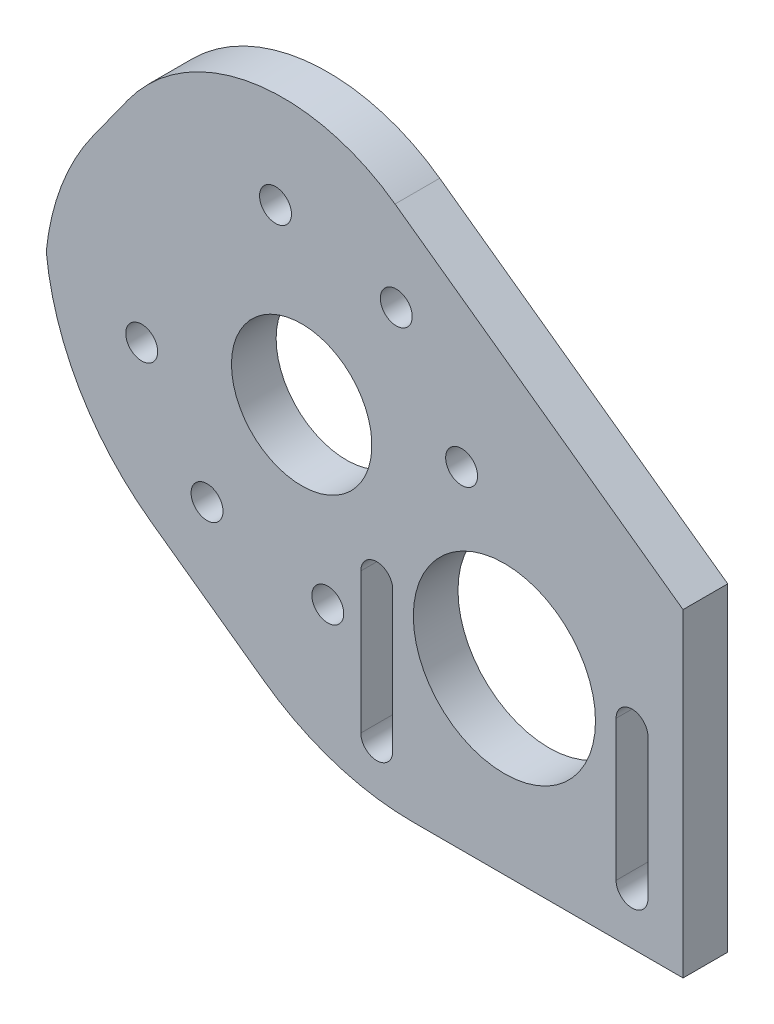
from build123d import *

# Parameters (mm, degrees)
SKETCH1_W               = 100
SKETCH1_H               = 100
BOSS_EXTRUDE1_DEPTH     = 7
SKETCH2_R               = 14.275
CUT_EXTRUDE1_DEPTH      = 142.594491418
SKETCH3_R               = 11
CUT_EXTRUDE2_DEPTH      = 10
SKETCH6_R               = 2.5
CUT_EXTRUDE3_DEPTH      = 142.594491418
CUT_EXTRUDE4_DEPTH      = 142.594491418
CUT_EXTRUDE4_DEPTH_BACK = 142.594491418
FILLET1_R               = 30
FILLET2_R               = 40


with BuildPart() as part:
    # Sketch1 → Boss-Extrude1 (new body)
    with BuildSketch(Plane.XY):
        with Locations((50, 50)):
            Rectangle(SKETCH1_W, SKETCH1_H)
    extrude(amount=BOSS_EXTRUDE1_DEPTH)

    # Sketch2 → Cut-Extrude1 (cut, through all)
    with BuildSketch(Plane.XY.offset(7)):
        with Locations((72, 28)):
            Circle(SKETCH2_R)
        with BuildLine():
            Line((54.5, 30), (54.5, 8))
            ThreePointArc((54.5, 8), (52, 5.5), (49.5, 8))
            Line((49.5, 8), (49.5, 30))
            ThreePointArc((49.5, 30), (52, 32.5), (54.5, 30))
        make_face()
        with BuildLine():
            Line((94.5, 30), (94.5, 8))
            ThreePointArc((94.5, 8), (92, 5.5), (89.5, 8))
            Line((89.5, 8), (89.5, 30))
            ThreePointArc((89.5, 30), (92, 32.5), (94.5, 30))
        make_face()
    extrude(amount=-CUT_EXTRUDE1_DEPTH, mode=Mode.SUBTRACT)

    # Sketch3 → Cut-Extrude2 (cut)
    with BuildSketch(Plane(origin=(0, 0, 0), x_dir=(-1, 0, 0), z_dir=(0, 0, -1))):
        with Locations((-40.225524413, 47.915639612)):
            Circle(SKETCH3_R)
    extrude(amount=-CUT_EXTRUDE2_DEPTH, mode=Mode.SUBTRACT)

    # Sketch6 → Cut-Extrude3 (cut, through all)
    with BuildSketch(Plane(origin=(0, 0, 0), x_dir=(-1, 0, 0), z_dir=(0, 0, -1))):
        with Locations((-15.158085821, 43.818869855)):
            Circle(SKETCH6_R)
        with Locations((-36.128754655, 72.983078204)):
            Circle(SKETCH6_R)
        with Locations((-25.397022274, 27.293430121)):
            Circle(SKETCH6_R)
        with Locations((-44.322294171, 22.848201021)):
            Circle(SKETCH6_R)
        with Locations((-55.054026552, 68.537849104)):
            Circle(SKETCH6_R)
        with Locations((-65.292963005, 52.01240937)):
            Circle(SKETCH6_R)
    extrude(amount=-CUT_EXTRUDE3_DEPTH, mode=Mode.SUBTRACT)

    # Sketch7 → Cut-Extrude4 (cut, two sides: drawn at the far end of the back side and taken through both)
    with BuildSketch(Plane(origin=(0, 0, 0), x_dir=(-1, 0, 0), z_dir=(0, 0, -1)).offset(-CUT_EXTRUDE4_DEPTH_BACK)):
        Polygon((-100, 100), (-100, 50), (-30.50895185, 100), align=None)
        Polygon((0, 100), (-30.50895185, 100), (0, 57.59801916), align=None)
        Polygon((0, 32.194859297), (-44.745090352, 0), (0, 0), align=None)
    extrude(amount=CUT_EXTRUDE4_DEPTH + CUT_EXTRUDE4_DEPTH_BACK, mode=Mode.SUBTRACT)

    # Fillet1
    fillet1_edges = [part.edges().sort_by_distance(p)[0] for p in [
        (30.50895185, 100, 3.5),
    ]]
    fillet(fillet1_edges, radius=FILLET1_R)

    # Fillet2
    # the kernel refuses this fillet: 40 mm, written as the material it takes off along each edge
    with BuildSketch(Plane(origin=(44.745090352, 0, 39.23712894), x_dir=(-0.8117201564538461, 0.5840465628753787, 0), z_dir=(0, 0, -1))) as fillet2_piece_1:
        with BuildLine():
            CenterArc((FILLET2_R * 0.322371289404, FILLET2_R), FILLET2_R, 234.264337428, 35.735662572)
            Line((-FILLET2_R * 0.261675273471, FILLET2_R * 0.188279843546), (0, 0))
            Line((0, 0), (FILLET2_R * 0.322371289404, 0))
        make_face()
    extrude(amount=71.474257881, mode=Mode.SUBTRACT)
    with BuildSketch(Plane(origin=(0, 32.194859297, -51.243453032), x_dir=(0, 1, 0), z_dir=(0, 0, 1))) as fillet2_piece_2:
        with BuildLine():
            CenterArc((FILLET2_R * 0.512434530321, -FILLET2_R), FILLET2_R, 90, 54.264337428)
            Line((-FILLET2_R * 0.299285626133, -FILLET2_R * 0.415953437125), (0, 0))
            Line((0, 0), (FILLET2_R * 0.512434530321, 0))
        make_face()
    extrude(amount=109.486906064, mode=Mode.SUBTRACT)
    with BuildSketch(Plane(origin=(0, 57.59801916, -32.23712894), x_dir=(0.5840465628753787, 0.8117201564538461, 0), z_dir=(0, 0, 1))) as fillet2_piece_3:
        with BuildLine():
            CenterArc((FILLET2_R * 0.322371289404, -FILLET2_R), FILLET2_R, 90, 35.735662572)
            Line((-FILLET2_R * 0.261675273471, -FILLET2_R * 0.188279843546), (0, 0))
            Line((0, 0), (FILLET2_R * 0.322371289404, 0))
        make_face()
    extrude(amount=71.474257881, mode=Mode.SUBTRACT)


solid = part.part
